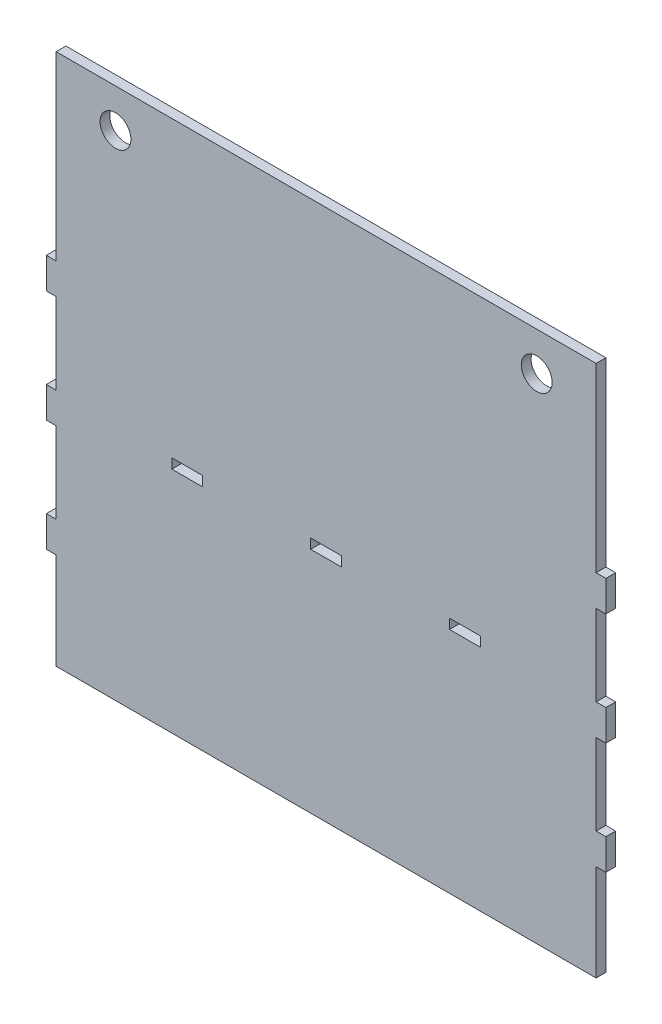
from build123d import *

# Parameters (mm, degrees)
CROQUIS1_W              = 350
CROQUIS1_H              = 345
SALIENTE_EXTRUIR1_DEPTH = 6.35
CROQUIS2_W              = 6.35
CROQUIS2_H              = 20
SALIENTE_EXTRUIR2_DEPTH = 6.35
CROQUIS3_W              = 20
CROQUIS3_H              = 6.35
CORTAR_EXTRUIR1_DEPTH   = 10
CROQUIS4_R              = 10
CORTAR_EXTRUIR2_DEPTH   = 251.368518388


with BuildPart() as part:
    # Croquis1 → Saliente-Extruir1 (new body)
    with BuildSketch(Plane.XY):
        Rectangle(CROQUIS1_W, CROQUIS1_H)
    extrude(amount=SALIENTE_EXTRUIR1_DEPTH)

    # Croquis2 → Saliente-Extruir2 (add)
    with BuildSketch(Plane.ZY.offset(175)):
        with Locations((3.175, 45)):
            Rectangle(CROQUIS2_W, CROQUIS2_H)
        with Locations((3.175, -27.5)):
            Rectangle(CROQUIS2_W, CROQUIS2_H)
        with Locations((3.175, -100)):
            Rectangle(CROQUIS2_W, CROQUIS2_H)
    saliente_extruir2 = extrude(amount=SALIENTE_EXTRUIR2_DEPTH)

    # Simetría1: Saliente-Extruir2 across plane
    add(saliente_extruir2.mirror(Plane(origin=(0, 0, 0), x_dir=(0, 0, 1), z_dir=(1, 0, 0))))

    # Croquis3 → Cortar-Extruir1 (cut)
    with BuildSketch(Plane.XY.offset(6.35)):
        with Locations((0, -21.165)):
            Rectangle(CROQUIS3_W, CROQUIS3_H)
        with Locations((90, -21.165)):
            Rectangle(CROQUIS3_W, CROQUIS3_H)
        with Locations((-90, -21.165)):
            Rectangle(CROQUIS3_W, CROQUIS3_H)
    extrude(amount=-CORTAR_EXTRUIR1_DEPTH, mode=Mode.SUBTRACT)

    # Croquis4 → Cortar-Extruir2 (cut, through all)
    with BuildSketch(Plane.XY.offset(6.35)):
        with Locations((-136.525, 147.5)):
            Circle(CROQUIS4_R)
        with Locations((136.525, 147.5)):
            Circle(CROQUIS4_R)
    extrude(amount=-CORTAR_EXTRUIR2_DEPTH, mode=Mode.SUBTRACT)


solid = part.part
